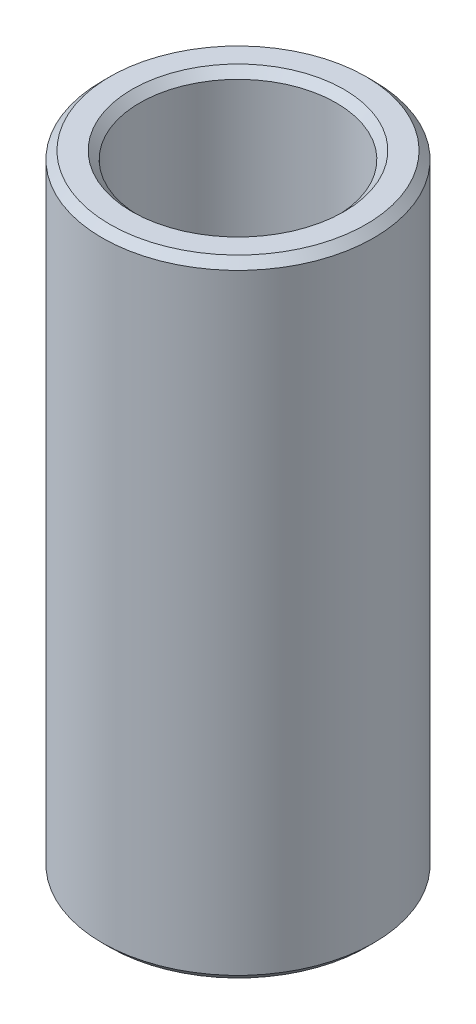
from build123d import *

# Parameters (mm, degrees)
SKETCH1_R           = 22.5
BOSS_EXTRUDE1_DEPTH = 103.716904787
SKETCH2_R           = 16.268044124
CUT_EXTRUDE1_DEPTH  = 109.488231337
CHAMFER1_SIZE       = 1.288765013


with BuildPart() as part:
    # Sketch1 → Boss-Extrude1 (new body)
    with BuildSketch(Plane(origin=(0, 0, 0), x_dir=(1, 0, 0), z_dir=(0, 1, 0))):
        Circle(SKETCH1_R)
    extrude(amount=BOSS_EXTRUDE1_DEPTH)

    # Sketch2 → Cut-Extrude1 (cut, through all)
    with BuildSketch(Plane(origin=(0, 0, 0), x_dir=(1, 0, 0), z_dir=(0, 1, 0))):
        Circle(SKETCH2_R)
    extrude(amount=CUT_EXTRUDE1_DEPTH, mode=Mode.SUBTRACT)

    # Chamfer1
    chamfer1_edges = [part.edges().sort_by_distance(p)[0] for p in [
        (-16.268044124, 103.716904787, 0),
        (-16.268044124, 0, 0),
        (-22.5, 0, 0),
        (-22.5, 103.716904787, 0),
    ]]
    chamfer(chamfer1_edges, length=CHAMFER1_SIZE)


solid = part.part
